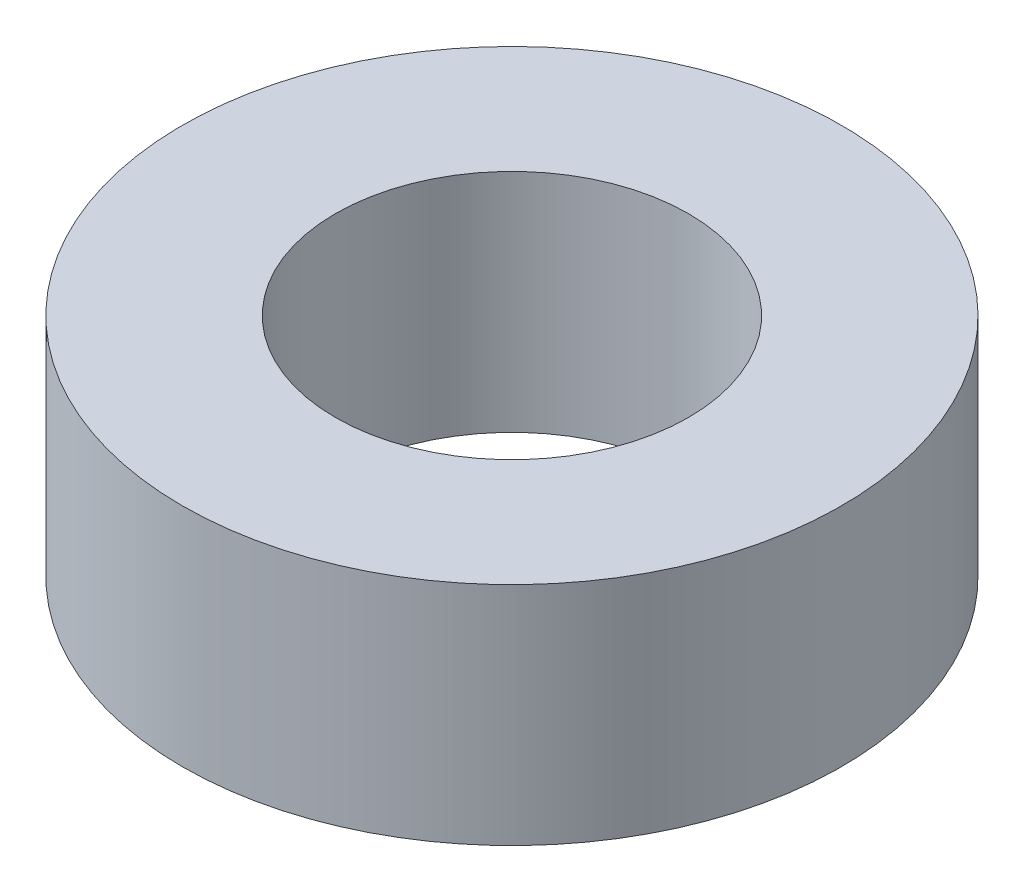
from build123d import *

# Parameters (mm, degrees)
SKETCH1_R        = 7
SKETCH1_R_2      = 3.75
EXTRUSION1_DEPTH = 4.8


with BuildPart() as part:
    # Sketch1 → Extrusion1 (new body)
    with BuildSketch(Plane(origin=(0, 0, 0), x_dir=(-1, 0, 0), z_dir=(0, 1, 0))):
        Circle(SKETCH1_R)
        Circle(SKETCH1_R_2, mode=Mode.SUBTRACT)
    extrude(amount=EXTRUSION1_DEPTH)


solid = part.part
